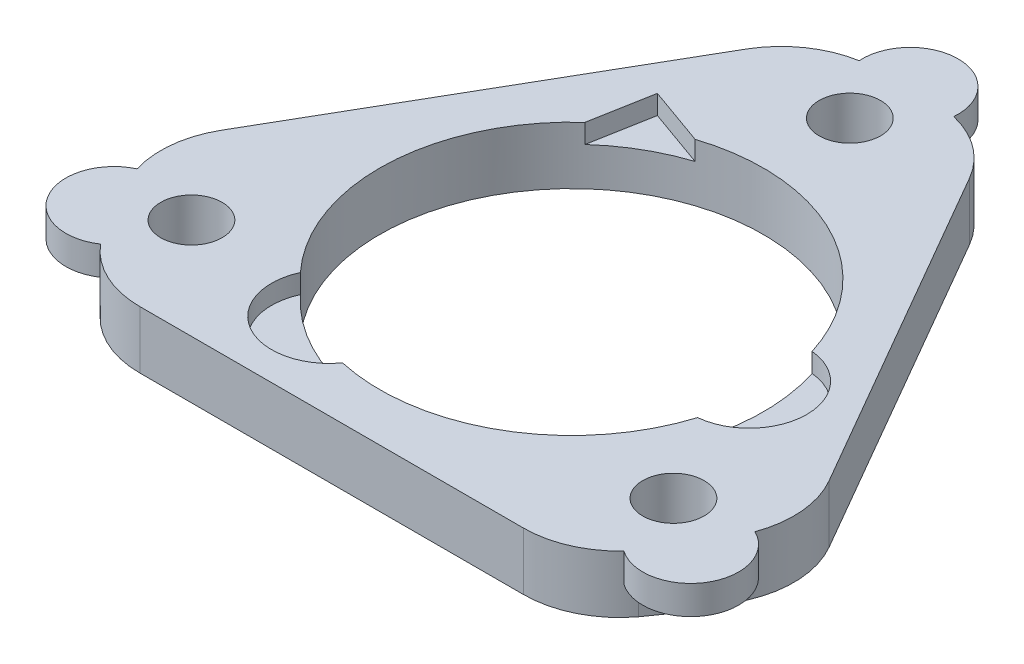
from build123d import *
from build123d.topology import SkipClean

# Parameters (mm, degrees)
SKETCH1_R           = 18.5
BOSS_EXTRUDE1_DEPTH = 3.5
SKETCH2_R           = 35
SKETCH2_R_2         = 20
SKETCH2_R_3         = 2.8
BOSS_EXTRUDE2_DEPTH = 6
SKETCH5_R           = 5
BOSS_EXTRUDE4_DEPTH = 3
CUT_EXTRUDE1_START  = -10
SKETCH3_R           = 18.5
CUT_EXTRUDE1_DEPTH  = 10
SKETCH12_R          = 72.135852014
CUT_EXTRUDE2_DEPTH  = 22
FILLET1_R           = 10
SKETCH15_R          = 20
SKETCH15_R_2        = 6
CUT_EXTRUDE4_DEPTH  = 2
SKETCH4_R           = 3.2
CUT_EXTRUDE5_DEPTH  = 10


with BuildPart() as part:
    # Sketch1 → Boss-Extrude1 (new body)
    with BuildSketch(Plane(origin=(0, 0, 0), x_dir=(1, 0, 0), z_dir=(0, 1, 0))):
        with Locations(Location((0, 0, 0), (0, 0, 270))):
            Circle(SKETCH1_R)
    extrude(amount=BOSS_EXTRUDE1_DEPTH)

    # Sketch3 → Cut-Extrude1 (cut)
    with BuildSketch(Plane(origin=(0, 3.5, 0), x_dir=(1, 0, 0), z_dir=(0, 1, 0)).offset(CUT_EXTRUDE1_START)):
        Circle(SKETCH3_R)
    extrude(amount=CUT_EXTRUDE1_DEPTH, mode=Mode.SUBTRACT)


with BuildPart() as body_2:
    # Sketch2 → Boss-Extrude2 (new body)
    with BuildSketch(Plane(origin=(0, 0, 0), x_dir=(1, 0, 0), z_dir=(0, 1, 0))):
        with Locations(Location((0, 0, 0), (0, 0, 270))):
            Circle(SKETCH2_R)
        with Locations(Location((0, 0, 0), (0, 0, 270))):
            Circle(SKETCH2_R_2, mode=Mode.SUBTRACT)
        with Locations(Location((0, 29, 0), (0, 0, 270))):
            Circle(SKETCH2_R_3, mode=Mode.SUBTRACT)
        with Locations(Location((25.11473671, -14.5, 0), (0, 0, 270))):
            Circle(SKETCH2_R_3, mode=Mode.SUBTRACT)
        with Locations(Location((-25.11473671, -14.5, 0), (0, 0, 270))):
            Circle(SKETCH2_R_3, mode=Mode.SUBTRACT)
    extrude(amount=BOSS_EXTRUDE2_DEPTH)

    # Sketch5 → Boss-Extrude4 (add)
    with BuildSketch(Plane(origin=(0, 6, 0), x_dir=(1, 0, 0), z_dir=(0, 1, 0))):
        with Locations((-30.453629482, -17.250404383)):
            Circle(SKETCH5_R)
        with Locations((0.28752632, 34.99881896)):
            Circle(SKETCH5_R)
        with Locations((30.166103162, -17.748414577)):
            Circle(SKETCH5_R)
    extrude(amount=-BOSS_EXTRUDE4_DEPTH)

    # Sketch12 → Cut-Extrude2 (cut)
    with BuildSketch(Plane(origin=(0, 6, 0), x_dir=(1, 0, 0), z_dir=(0, 1, 0))):
        Circle(SKETCH12_R)
        Polygon((0, 50), (-43.301270189, -25), (43.301270189, -25), align=None, mode=Mode.SUBTRACT)
    extrude(amount=-CUT_EXTRUDE2_DEPTH, mode=Mode.SUBTRACT)

    # Fillet1
    # the kernel refuses this fillet: 10 mm, written as the material it takes off along each edge
    with BuildSketch(Plane(origin=(-24.494897428, 19.2960859, 25), x_dir=(-0.6590478202651217, 0, -0.7521010374968192), z_dir=(0, -1, 0))) as fillet1_piece_1_section:
        with BuildLine():
            CenterArc((4.558658023, 9.971095222), FILLET1_R, 221.227294524, 53.130102354)
            Line((-2.962352352, 3.380617019), (0, 0))
            ThreePointArc((0, 0), (2.65921718, -0.101166725), (5.31843436, 0))
        make_face()
    fillet1_piece_1 = extrude(amount=32.5921718, mode=Mode.PRIVATE)
    fillet1_piece_1 = fillet1_piece_1 - Plane(origin=(-30.453629482, 4.5, 17.250404383), x_dir=(1, 0, 0), z_dir=(0, 1, 0)) * Cylinder(5, 87, mode=Mode.PRIVATE)
    add(fillet1_piece_1, mode=Mode.SUBTRACT)
    with BuildSketch(Plane(origin=(-24.494897428, 19.2960859, 25), x_dir=(-0.6590478202651217, 0, -0.7521010374968192), z_dir=(0, -1, 0))) as fillet1_piece_2_section:
        with BuildLine():
            CenterArc((4.558658023, 9.971095222), FILLET1_R, 221.227294524, 53.130102354)
            Line((-2.962352352, 3.380617019), (0, 0))
            ThreePointArc((0, 0), (2.65921718, -0.101166725), (5.31843436, 0))
        make_face()
    fillet1_piece_2 = extrude(amount=32.5921718, mode=Mode.PRIVATE)
    fillet1_piece_2 = split(fillet1_piece_2, bisect_by=Plane(origin=(-27.761621835, 3, 21.309124186), z_dir=(0, -1, 0)), keep=Keep.TOP, mode=Mode.PRIVATE)
    add(fillet1_piece_2, mode=Mode.SUBTRACT)
    with BuildSketch(Plane(origin=(24.494897428, 19.2960859, 25), x_dir=(-1, 0, 0), z_dir=(0, -1, 0))) as fillet1_piece_3_section:
        with BuildLine():
            CenterArc((4.494897428, 10), FILLET1_R, 216.869897646, 53.130102354)
            ThreePointArc((-3.505102572, 4), (-1.828638885, 1.933326291), (0, 0))
            Line((0, 0), (4.494897428, 0))
        make_face()
    fillet1_piece_3 = extrude(amount=32.5921718, mode=Mode.PRIVATE)
    fillet1_piece_3 = fillet1_piece_3 - Plane(origin=(30.166103162, 4.5, 17.748414577), x_dir=(1, 0, 0), z_dir=(0, 1, 0)) * Cylinder(5, 84, mode=Mode.PRIVATE)
    add(fillet1_piece_3, mode=Mode.SUBTRACT)
    with BuildSketch(Plane(origin=(24.494897428, 19.2960859, 25), x_dir=(-1, 0, 0), z_dir=(0, -1, 0))) as fillet1_piece_4_section:
        with BuildLine():
            CenterArc((4.494897428, 10), FILLET1_R, 216.869897646, 53.130102354)
            ThreePointArc((-3.505102572, 4), (-1.828638885, 1.933326291), (0, 0))
            Line((0, 0), (4.494897428, 0))
        make_face()
    fillet1_piece_4 = extrude(amount=32.5921718, mode=Mode.PRIVATE)
    fillet1_piece_4 = split(fillet1_piece_4, bisect_by=Plane(origin=(27.488157838, 3, 21.643747381), z_dir=(0, -1, 0)), keep=Keep.TOP, mode=Mode.PRIVATE)
    add(fillet1_piece_4, mode=Mode.SUBTRACT)
    with BuildSketch(Plane(origin=(-9.403186381, 19.2960859, -33.713203436), x_dir=(-0.5000000000000003, 0, 0.8660254037844386), z_dir=(0, -1, 0))) as fillet1_piece_5_section:
        with BuildLine():
            CenterArc((4.494897428, -10), FILLET1_R, 90, 53.130102354)
            ThreePointArc((-3.505102572, -4), (-1.828638885, -1.933326291), (0, 0))
            Line((0, 0), (4.494897428, 0))
        make_face()
    fillet1_piece_5 = extrude(amount=32.5921718, mode=Mode.PRIVATE)
    fillet1_piece_5 = fillet1_piece_5 - Plane(origin=(0.28752632, 4.5, -34.99881896), x_dir=(1, 0, 0), z_dir=(0, 1, 0)) * Cylinder(5, 84, mode=Mode.PRIVATE)
    add(fillet1_piece_5, mode=Mode.SUBTRACT)
    with BuildSketch(Plane(origin=(-9.403186381, 19.2960859, -33.713203436), x_dir=(-0.5000000000000003, 0, 0.8660254037844386), z_dir=(0, -1, 0))) as fillet1_piece_6_section:
        with BuildLine():
            CenterArc((4.494897428, -10), FILLET1_R, 90, 53.130102354)
            ThreePointArc((-3.505102572, -4), (-1.828638885, -1.933326291), (0, 0))
            Line((0, 0), (4.494897428, 0))
        make_face()
    fillet1_piece_6 = extrude(amount=32.5921718, mode=Mode.PRIVATE)
    fillet1_piece_6 = split(fillet1_piece_6, bisect_by=Plane(origin=(-4.57343196, 3, -34.696831852), z_dir=(0, -1, 0)), keep=Keep.TOP, mode=Mode.PRIVATE)
    add(fillet1_piece_6, mode=Mode.SUBTRACT)
    with BuildSketch(Plane(origin=(-33.898083809, 19.2960859, 8.713203436), x_dir=(0.32181469455231854, 0, 0.9468026734067654), z_dir=(0, -1, 0))) as fillet1_piece_7_section:
        with BuildLine():
            CenterArc((4.558658023, -9.971095222), FILLET1_R, 85.642603122, 53.130102354)
            Line((-2.962352352, -3.380617019), (0, 0))
            ThreePointArc((0, 0), (2.65921718, 0.101166725), (5.31843436, 0))
        make_face()
    fillet1_piece_7 = extrude(amount=32.5921718, mode=Mode.PRIVATE)
    fillet1_piece_7 = fillet1_piece_7 - Plane(origin=(-30.453629482, 4.5, 17.250404383), x_dir=(1, 0, 0), z_dir=(0, 1, 0)) * Cylinder(5, 87, mode=Mode.PRIVATE)
    add(fillet1_piece_7, mode=Mode.SUBTRACT)
    with BuildSketch(Plane(origin=(-33.898083809, 19.2960859, 8.713203436), x_dir=(0.32181469455231854, 0, 0.9468026734067654), z_dir=(0, -1, 0))) as fillet1_piece_8_section:
        with BuildLine():
            CenterArc((4.558658023, -9.971095222), FILLET1_R, 85.642603122, 53.130102354)
            Line((-2.962352352, -3.380617019), (0, 0))
            ThreePointArc((0, 0), (2.65921718, 0.101166725), (5.31843436, 0))
        make_face()
    fillet1_piece_8 = extrude(amount=32.5921718, mode=Mode.PRIVATE)
    fillet1_piece_8 = split(fillet1_piece_8, bisect_by=Plane(origin=(-32.488113984, 3, 12.9835693), z_dir=(0, -1, 0)), keep=Keep.TOP, mode=Mode.PRIVATE)
    add(fillet1_piece_8, mode=Mode.SUBTRACT)
    with BuildSketch(Plane(origin=(33.898083809, 19.2960859, 8.713203436), x_dir=(-0.3218146945523175, 0, 0.9468026734067657), z_dir=(0, -1, 0))) as fillet1_piece_9_section:
        with BuildLine():
            CenterArc((4.558658023, 9.971095222), FILLET1_R, 221.227294524, 53.130102354)
            Line((-2.962352352, 3.380617019), (0, 0))
            ThreePointArc((0, 0), (2.65921718, -0.101166725), (5.31843436, 0))
        make_face()
    fillet1_piece_9 = extrude(amount=32.5921718, mode=Mode.PRIVATE)
    fillet1_piece_9 = fillet1_piece_9 - Plane(origin=(30.166103162, 4.5, 17.748414577), x_dir=(1, 0, 0), z_dir=(0, 1, 0)) * Cylinder(5, 87, mode=Mode.PRIVATE)
    add(fillet1_piece_9, mode=Mode.SUBTRACT)
    with BuildSketch(Plane(origin=(33.898083809, 19.2960859, 8.713203436), x_dir=(-0.3218146945523175, 0, 0.9468026734067657), z_dir=(0, -1, 0))) as fillet1_piece_10_section:
        with BuildLine():
            CenterArc((4.558658023, 9.971095222), FILLET1_R, 221.227294524, 53.130102354)
            Line((-2.962352352, 3.380617019), (0, 0))
            ThreePointArc((0, 0), (2.65921718, -0.101166725), (5.31843436, 0))
        make_face()
    fillet1_piece_10 = extrude(amount=32.5921718, mode=Mode.PRIVATE)
    fillet1_piece_10 = split(fillet1_piece_10, bisect_by=Plane(origin=(32.335053795, 3, 13.387707666), z_dir=(0, -1, 0)), keep=Keep.TOP, mode=Mode.PRIVATE)
    add(fillet1_piece_10, mode=Mode.SUBTRACT)
    with BuildSketch(Plane(origin=(9.403186381, 19.2960859, -33.713203436), x_dir=(-0.9808625148174394, 0, -0.19470163590994477), z_dir=(0, -1, 0))) as fillet1_piece_11_section:
        with BuildLine():
            CenterArc((4.558658023, -9.971095222), FILLET1_R, 85.642603122, 53.130102354)
            Line((-2.962352352, -3.380617019), (0, 0))
            ThreePointArc((0, 0), (2.65921718, 0.101166725), (5.31843436, 0))
        make_face()
    fillet1_piece_11 = extrude(amount=32.5921718, mode=Mode.PRIVATE)
    fillet1_piece_11 = fillet1_piece_11 - Plane(origin=(0.28752632, 4.5, -34.99881896), x_dir=(1, 0, 0), z_dir=(0, 1, 0)) * Cylinder(5, 87, mode=Mode.PRIVATE)
    add(fillet1_piece_11, mode=Mode.SUBTRACT)
    with BuildSketch(Plane(origin=(9.403186381, 19.2960859, -33.713203436), x_dir=(-0.9808625148174394, 0, -0.19470163590994477), z_dir=(0, -1, 0))) as fillet1_piece_12_section:
        with BuildLine():
            CenterArc((4.558658023, -9.971095222), FILLET1_R, 85.642603122, 53.130102354)
            Line((-2.962352352, -3.380617019), (0, 0))
            ThreePointArc((0, 0), (2.65921718, 0.101166725), (5.31843436, 0))
        make_face()
    fillet1_piece_12 = extrude(amount=32.5921718, mode=Mode.PRIVATE)
    fillet1_piece_12 = split(fillet1_piece_12, bisect_by=Plane(origin=(4.999956146, 3, -34.627316681), z_dir=(0, -1, 0)), keep=Keep.TOP, mode=Mode.PRIVATE)
    add(fillet1_piece_12, mode=Mode.SUBTRACT)

    # Sketch15 → Cut-Extrude4 (cut)
    with SkipClean():  # the faces are left unmerged after this step: merging them gives an invalid solid
        with BuildSketch(Plane(origin=(0, 6, 0), x_dir=(1, 0, 0), z_dir=(0, 1, 0))):
            with Locations(Location((0, 0, 0), (0, 0, 107.923924211))):
                Circle(SKETCH15_R)
            with Locations((-9.237551188, -16.028650849)):
                Circle(SKETCH15_R_2)
            with Locations((18.499994418, 0.014371427)):
                Circle(SKETCH15_R_2)
            with BuildLine():
                Line((-12.266478871, 21.208099776), (-13.42538307, 14.824273656))
                ThreePointArc((-13.42538307, 14.824273656), (-10.01345214, 17.312734511), (-6.155078704, 19.029319645))
                Line((-6.155078704, 19.029319645), (-12.266478871, 21.208099776))
            make_face()
        extrude(amount=-CUT_EXTRUDE4_DEPTH, mode=Mode.SUBTRACT)

    # Sketch4 → Cut-Extrude5 (cut)
    with SkipClean():  # the faces are left unmerged after this step: merging them gives an invalid solid
        with BuildSketch(Plane.XZ):
            with Locations(Location((-25.11473671, 14.5, 0), (0, 0, 270))):
                Circle(SKETCH4_R)
            with Locations(Location((25.11473671, 14.5, 0), (0, 0, 270))):
                Circle(SKETCH4_R)
            with Locations(Location((0, -29, 0), (0, 0, 270))):
                Circle(SKETCH4_R)
        extrude(amount=-CUT_EXTRUDE5_DEPTH, mode=Mode.SUBTRACT)


solid = body_2.part
